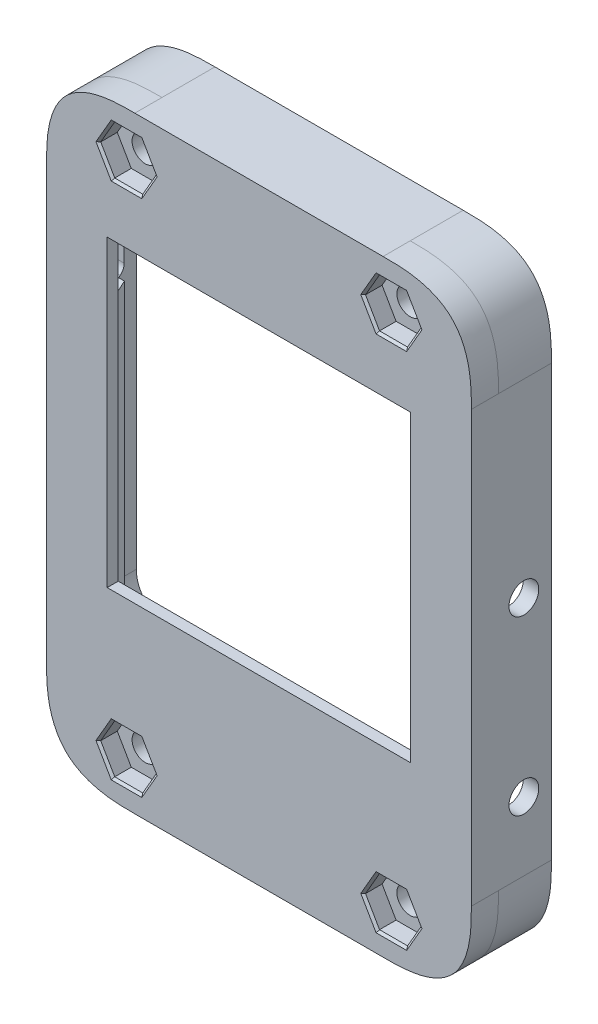
from build123d import *

# Parameters (mm, degrees)
SKETCH_2_W             = 38.5
SKETCH_2_H             = 55
EXTRUDE_1_DEPTH        = 2.46
SKETCH_3_W             = 27.51
SKETCH_3_H             = 27.51
CUT_EXTRUDE_2262_DEPTH = 34.658046586
CUT_EXTRUDE_START      = -1.46
SKETCH_4_W             = 32
SKETCH_4_H             = 37.52
CUT_EXTRUDE_2836_DEPTH = 1.46
FILLET_1_SIZE          = 8
EXTRUDE_3940_DEPTH     = 4.8000508
SKETCH_6_W             = 21
SKETCH_6_H             = 1.5
CUT_EXTRUDE_4625_DEPTH = 1.46
PCB_START              = -1.600051
PCB_DEPTH              = 1.600051
USB_START              = -1.4
USB_DEPTH              = 1.4
SKETCH_9_R             = 3.4
SKETCH_9_R_2           = 1.2
EXTRUDE_2_DEPTH        = 4.8000508
SKETCH_9_2_R           = 1.2
CUT_EXTRUDE_6596_DEPTH = 35.344153046
CUT_EXTRUDE_7273_DEPTH = 1.7
CUT_EXTRUDE_7526_REACH = 49.556
SKETCH_11_R            = 1.35
USB_2_R                = 1
USB_3_SIZE             = 0.2
CHAMFER_8047_SIZE      = 0.2


with BuildPart() as part:
    # 草图2 → 凸台-拉伸1 (new body)
    with BuildSketch(Plane.XY):
        Rectangle(SKETCH_2_W, SKETCH_2_H)
    extrude(amount=EXTRUDE_1_DEPTH)

    # 草图3 → Cut-Extrude 2262 (cut, through all)
    with BuildSketch(Plane.XY.offset(2.46)):
        with Locations((0, 2.765)):
            Rectangle(SKETCH_3_W, SKETCH_3_H)
    extrude(amount=-CUT_EXTRUDE_2262_DEPTH, mode=Mode.SUBTRACT)

    # 草图4 → Cut-Extrude 2836 (cut)
    with BuildSketch(Plane(origin=(0, 0, 0), x_dir=(-1, 0, 0), z_dir=(0, 0, -1)).offset(CUT_EXTRUDE_START)):
        Rectangle(SKETCH_4_W, SKETCH_4_H)
    extrude(amount=CUT_EXTRUDE_2836_DEPTH, mode=Mode.SUBTRACT)

    # 圆角1
    # a fillet whose section is not a circle: 8 mm, written as the material it takes off along each edge
    with BuildSketch(Plane(origin=(19.25, -27.5, -20), x_dir=(0, 1, 0), z_dir=(0, 0, 1)), Plane(origin=(19.25, 27.5, -20), x_dir=(-1, 0, 0), z_dir=(0, 0, 1))) as fillet_1_piece_1:
        with BuildLine():
            add(Edge.make_bspline([(FILLET_1_SIZE, 0), (FILLET_1_SIZE * 0.831801948466, 0), (FILLET_1_SIZE * 0.663603896932, 0), (FILLET_1_SIZE * 0.292893218813, FILLET_1_SIZE * 0.0716919198361), (FILLET_1_SIZE * 0.0716919198361, FILLET_1_SIZE * 0.292893218813), (0, FILLET_1_SIZE * 0.663603896932), (0, FILLET_1_SIZE * 0.831801948466), (0, FILLET_1_SIZE)], knots=[0, 0, 0, 0, 0, 0, 0.5, 0.5, 1, 1, 1, 1, 1, 1], degree=5))
            Line((0, FILLET_1_SIZE), (0, 0))
            Line((0, 0), (FILLET_1_SIZE, 0))
        make_face()
    extrude(amount=42.46, mode=Mode.SUBTRACT)
    with BuildSketch(Plane(origin=(-19.25, -27.5, -20), x_dir=(0, 1, 0), z_dir=(0, 0, 1)), Plane(origin=(-19.25, 27.5, -20), x_dir=(1, 0, 0), z_dir=(0, 0, 1))) as fillet_1_piece_2:
        with BuildLine():
            add(Edge.make_bspline([(FILLET_1_SIZE, 0), (FILLET_1_SIZE * 0.831801948466, 0), (FILLET_1_SIZE * 0.663603896932, 0), (FILLET_1_SIZE * 0.292893218813, -FILLET_1_SIZE * 0.0716919198361), (FILLET_1_SIZE * 0.0716919198361, -FILLET_1_SIZE * 0.292893218813), (0, -FILLET_1_SIZE * 0.663603896932), (0, -FILLET_1_SIZE * 0.831801948466), (0, -FILLET_1_SIZE)], knots=[0, 0, 0, 0, 0, 0, 0.5, 0.5, 1, 1, 1, 1, 1, 1], degree=5))
            Line((0, -FILLET_1_SIZE), (0, 0))
            Line((0, 0), (FILLET_1_SIZE, 0))
        make_face()
    extrude(amount=42.46, mode=Mode.SUBTRACT)

    # Extrude 3940: read off the stored shape, not the designer's step
    # Extrude 3940 outline → Extrude 3940 (add)
    with BuildSketch(Plane(origin=(0, 0, 0), x_dir=(-1, 0, 0), z_dir=(0, 0, -1))):
        with BuildLine():
            Line((19.25, -19.5), (19.25, 19.5))
            add(Edge.make_bspline(
                [(19.25, 19.5), (19.25, 20.580020252), (19.21236359, 21.161838265), (19.154343151, 22.058771223), (18.987229849, 22.808455098), (18.574914705, 24.65813439), (17.495660449, 25.739618136), (16.416563674, 26.820944075), (14.566335811, 27.235468819), (13.817055919, 27.403337362), (12.9181968, 27.461950617), (12.334693381, 27.5), (11.25, 27.5)],
                knots=[0, 0, 0, 0.125, 0.125, 0.25, 0.25, 0.5, 0.5, 0.75, 0.75, 0.875, 0.875, 1, 1, 1], degree=2))
            Line((11.25, 27.5), (-11.25, 27.5))
            add(Edge.make_bspline(
                [(-11.25, 27.5), (-12.330020252, 27.5), (-12.911838265, 27.46236359), (-13.808771223, 27.404343151), (-14.558455098, 27.237229849), (-16.40813439, 26.824914705), (-17.489618136, 25.745660449), (-18.570944075, 24.666563674), (-18.985468819, 22.816335811), (-19.153337362, 22.067055919), (-19.211950617, 21.1681968), (-19.25, 20.584693381), (-19.25, 19.5)],
                knots=[0, 0, 0, 0.125, 0.125, 0.25, 0.25, 0.5, 0.5, 0.75, 0.75, 0.875, 0.875, 1, 1, 1], degree=2))
            Line((-19.25, 19.5), (-19.25, -19.5))
            add(Edge.make_bspline(
                [(-19.25, -19.5), (-19.25, -20.580020252), (-19.21236359, -21.161838265), (-19.154343151, -22.058771223), (-18.987229849, -22.808455098), (-18.574914705, -24.65813439), (-17.495660449, -25.739618136), (-16.416563674, -26.820944075), (-14.566335811, -27.235468819), (-13.817055919, -27.403337362), (-12.9181968, -27.461950617), (-12.334693381, -27.5), (-11.25, -27.5)],
                knots=[0, 0, 0, 0.125, 0.125, 0.25, 0.25, 0.5, 0.5, 0.75, 0.75, 0.875, 0.875, 1, 1, 1], degree=2))
            Line((-11.25, -27.5), (11.25, -27.5))
            add(Edge.make_bspline(
                [(11.25, -27.5), (12.330020252, -27.5), (12.911838265, -27.46236359), (13.808771223, -27.404343151), (14.558455098, -27.237229849), (16.40813439, -26.824914705), (17.489618136, -25.745660449), (18.570944075, -24.666563674), (18.985468819, -22.816335811), (19.153337362, -22.067055919), (19.211950617, -21.1681968), (19.25, -20.584693381), (19.25, -19.5)],
                knots=[0, 0, 0, 0.125, 0.125, 0.25, 0.25, 0.5, 0.5, 0.75, 0.75, 0.875, 0.875, 1, 1, 1], degree=2))
        make_face()
        with BuildLine():
            add(Edge.make_bspline(
                [(17.85, 19.5), (17.85, 20.424125747), (17.842147155, 21.347514943), (17.586385916, 22.709714643), (17.460471496, 23.163708055), (17.182141078, 23.800860799), (17.073157778, 24.008205895), (16.818119881, 24.399226199), (16.673896997, 24.580261327), (16.347287429, 24.909260217), (16.162971776, 25.057823386), (15.774899827, 25.313594138), (15.569880563, 25.422737913), (15.14250697, 25.611445355), (14.922539396, 25.689860704), (14.478900883, 25.821044568), (14.254207223, 25.874300082), (13.573156016, 26.004151683), (13.108502387, 26.053008887), (12.179957339, 26.097214313), (11.715026161, 26.1), (11.25, 26.1)],
                knots=[0, 0, 0, 0, 0.25, 0.25, 0.375, 0.375, 0.4375, 0.4375, 0.5, 0.5, 0.5625, 0.5625, 0.625, 0.625, 0.6875, 0.6875, 0.75, 0.75, 0.875, 0.875, 1, 1, 1, 1], degree=3))
            Line((17.85, 19.5), (17.85, -19.5))
            add(Edge.make_bspline(
                [(11.25, -26.1), (12.174125747, -26.1), (13.097514943, -26.092147155), (14.459714643, -25.836385916), (14.913708055, -25.710471496), (15.550860799, -25.432141078), (15.758205895, -25.323157778), (16.149226199, -25.068119881), (16.330261327, -24.923896997), (16.659260217, -24.597287429), (16.807823386, -24.412971776), (17.063594138, -24.024899827), (17.172737913, -23.819880563), (17.361445355, -23.39250697), (17.439860704, -23.172539396), (17.571044568, -22.728900883), (17.624300082, -22.504207223), (17.754151683, -21.823156016), (17.803008887, -21.358502387), (17.847214313, -20.429957339), (17.85, -19.965026161), (17.85, -19.5)],
                knots=[0, 0, 0, 0, 0.25, 0.25, 0.375, 0.375, 0.4375, 0.4375, 0.5, 0.5, 0.5625, 0.5625, 0.625, 0.625, 0.6875, 0.6875, 0.75, 0.75, 0.875, 0.875, 1, 1, 1, 1], degree=3))
            Line((11.25, -26.1), (-11.25, -26.1))
            add(Edge.make_bspline(
                [(-17.85, -19.5), (-17.85, -20.424125747), (-17.842147155, -21.347514943), (-17.586385916, -22.709714643), (-17.460471496, -23.163708055), (-17.182141078, -23.800860799), (-17.073157778, -24.008205895), (-16.818119881, -24.399226199), (-16.673896997, -24.580261327), (-16.347287429, -24.909260217), (-16.162971776, -25.057823386), (-15.774899827, -25.313594138), (-15.569880563, -25.422737913), (-15.14250697, -25.611445355), (-14.922539396, -25.689860704), (-14.478900883, -25.821044568), (-14.254207223, -25.874300082), (-13.573156016, -26.004151683), (-13.108502387, -26.053008887), (-12.179957339, -26.097214313), (-11.715026161, -26.1), (-11.25, -26.1)],
                knots=[0, 0, 0, 0, 0.25, 0.25, 0.375, 0.375, 0.4375, 0.4375, 0.5, 0.5, 0.5625, 0.5625, 0.625, 0.625, 0.6875, 0.6875, 0.75, 0.75, 0.875, 0.875, 1, 1, 1, 1], degree=3))
            Line((-17.85, -19.5), (-17.85, 19.5))
            add(Edge.make_bspline(
                [(-11.25, 26.1), (-12.174125747, 26.1), (-13.097514943, 26.092147155), (-14.459714643, 25.836385916), (-14.913708055, 25.710471496), (-15.550860799, 25.432141078), (-15.758205895, 25.323157778), (-16.149226199, 25.068119881), (-16.330261327, 24.923896997), (-16.659260217, 24.597287429), (-16.807823386, 24.412971776), (-17.063594138, 24.024899827), (-17.172737913, 23.819880563), (-17.361445355, 23.39250697), (-17.439860704, 23.172539396), (-17.571044568, 22.728900883), (-17.624300082, 22.504207223), (-17.754151683, 21.823156016), (-17.803008887, 21.358502387), (-17.847214313, 20.429957339), (-17.85, 19.965026161), (-17.85, 19.5)],
                knots=[0, 0, 0, 0, 0.25, 0.25, 0.375, 0.375, 0.4375, 0.4375, 0.5, 0.5, 0.5625, 0.5625, 0.625, 0.625, 0.6875, 0.6875, 0.75, 0.75, 0.875, 0.875, 1, 1, 1, 1], degree=3))
            Line((-11.25, 26.1), (11.25, 26.1))
        make_face(mode=Mode.SUBTRACT)
    extrude(amount=EXTRUDE_3940_DEPTH)

    # 草图6 → Cut-Extrude 4625 (cut)
    with BuildSketch(Plane(origin=(0, 0, 0), x_dir=(-1, 0, 0), z_dir=(0, 0, -1))):
        with Locations((2.5, -19.51)):
            Rectangle(SKETCH_6_W, SKETCH_6_H)
    extrude(amount=-CUT_EXTRUDE_4625_DEPTH, mode=Mode.SUBTRACT)

    # 草图7 → PCB干涉 (cut)
    with BuildSketch(Plane(origin=(0, 0, -4.8000508), x_dir=(-1, 0, 0), z_dir=(0, 0, -1)).offset(PCB_START)):
        with BuildLine():
            Line((18.375336551, -15.50003175), (18.375336551, 15.50003175))
            ThreePointArc((18.375336551, 15.50003175), (17.471085836, 17.68308609), (15.288031496, 18.587336805))
            Line((15.288031496, 18.587336805), (-11.712024384, 18.587336805))
            ThreePointArc((-11.712024384, 18.587336805), (-13.895078724, 17.68308609), (-14.799329439, 15.50003175))
            Line((-14.799329439, 15.50003175), (-14.799329439, -15.50003175))
            ThreePointArc((-14.799329439, -15.50003175), (-13.895078724, -17.68308609), (-11.712024384, -18.587336805))
            Line((-11.712024384, -18.587336805), (15.288031496, -18.587336805))
            ThreePointArc((15.288031496, -18.587336805), (17.471085836, -17.68308609), (18.375336551, -15.50003175))
        make_face()
    extrude(amount=PCB_DEPTH, mode=Mode.SUBTRACT)

    # 草图8 → USB (cut)
    with BuildSketch(Plane.ZY.offset(19.25).offset(USB_START)):
        Polygon((-2.39931547, 15.821951992), (-0.39931547, 15.821951992), (-0.39931547, 7.518335028), (-2.39931547, 7.518335028), (-3.702297433, 8.611666713), (-3.702297433, 14.728620308), align=None)
    extrude(amount=USB_DEPTH, mode=Mode.SUBTRACT)

    # 草图9 → 凸台-拉伸2 (add)
    # profile 1 of 4: a face of its own
    with BuildSketch(Plane(origin=(0, 0, -4.8000508), x_dir=(-1, 0, 0), z_dir=(0, 0, -1))):
        with Locations((-12, 23.5)):
            Circle(SKETCH_9_R)
        with Locations((-12, 23.5)):
            Circle(SKETCH_9_R_2, mode=Mode.SUBTRACT)
    # profile 2 of 4: a face of its own
    with BuildSketch(Plane(origin=(0, 0, -4.8000508), x_dir=(-1, 0, 0), z_dir=(0, 0, -1))):
        with Locations((12, 23.5)):
            Circle(SKETCH_9_R)
        with Locations((12, 23.5)):
            Circle(SKETCH_9_R_2, mode=Mode.SUBTRACT)
    # profile 3 of 4: a face of its own
    with BuildSketch(Plane(origin=(0, 0, -4.8000508), x_dir=(-1, 0, 0), z_dir=(0, 0, -1))):
        with Locations((-12, -23.5)):
            Circle(SKETCH_9_R)
        with Locations((-12, -23.5)):
            Circle(SKETCH_9_R_2, mode=Mode.SUBTRACT)
    # profile 4 of 4: a face of its own
    with BuildSketch(Plane(origin=(0, 0, -4.8000508), x_dir=(-1, 0, 0), z_dir=(0, 0, -1))):
        with BuildLine():
            Line((10.969272102, -20.26), (13.030727898, -20.26))
            ThreePointArc((13.030727898, -20.26), (12, -26.9), (10.969272102, -20.26))
        make_face()
        with Locations((12, -23.5)):
            Circle(SKETCH_9_R_2, mode=Mode.SUBTRACT)
    extrude(amount=-EXTRUDE_2_DEPTH)

    # 草图9<2> → Cut-Extrude 6596 (cut, through all)
    with BuildSketch(Plane(origin=(0, 0, -4.8000508), x_dir=(-1, 0, 0), z_dir=(0, 0, -1))):
        with Locations((-12, 23.5)):
            Circle(SKETCH_9_2_R)
        with Locations((12, 23.5)):
            Circle(SKETCH_9_2_R)
        with Locations((-12, -23.5)):
            Circle(SKETCH_9_2_R)
        with Locations((12, -23.5)):
            Circle(SKETCH_9_2_R)
    extrude(amount=-CUT_EXTRUDE_6596_DEPTH, mode=Mode.SUBTRACT)

    # 草图10 → Cut-Extrude 7273 (cut)
    with BuildSketch(Plane.XY.offset(2.46)):
        Polygon((-9.459658816, 23.5), (-10.729829408, 25.7), (-13.270170592, 25.7), (-14.540341184, 23.5), (-13.270170592, 21.3), (-10.729829408, 21.3), align=None)
        Polygon((14.540341184, 23.5), (13.270170592, 25.7), (10.729829408, 25.7), (9.459658816, 23.5), (10.729829408, 21.3), (13.270170592, 21.3), align=None)
        Polygon((-9.459658816, -23.5), (-10.729829408, -21.3), (-13.270170592, -21.3), (-14.540341184, -23.5), (-13.270170592, -25.7), (-10.729829408, -25.7), align=None)
        Polygon((14.540341184, -23.5), (13.270170592, -21.3), (10.729829408, -21.3), (9.459658816, -23.5), (10.729829408, -25.7), (13.270170592, -25.7), align=None)
    extrude(amount=-CUT_EXTRUDE_7273_DEPTH, mode=Mode.SUBTRACT)

    # 草图11 → Cut-Extrude 7526 (cut, up to next)
    with BuildSketch(Plane(origin=(19.25, 0, 0), x_dir=(0, 0, -1), z_dir=(1, 0, 0)), mode=Mode.PRIVATE) as cut_extrude_7526_sk1:
        with Locations(Location((2.29907464, -13.293026416, 0), (0, 0, 90))):
            Circle(SKETCH_11_R)
    cut_extrude_7526_tool1 = extrude(cut_extrude_7526_sk1.sketch, amount=-CUT_EXTRUDE_7526_REACH, mode=Mode.PRIVATE) & part.part
    # 草图11 → Cut-Extrude 7526 (cut, up to next)
    with BuildSketch(Plane(origin=(19.25, 0, 0), x_dir=(0, 0, -1), z_dir=(1, 0, 0)), mode=Mode.PRIVATE) as cut_extrude_7526_sk2:
        with Locations(Location((2.29907464, 2.328004826, 0), (0, 0, 90))):
            Circle(SKETCH_11_R)
    cut_extrude_7526_tool2 = extrude(cut_extrude_7526_sk2.sketch, amount=-CUT_EXTRUDE_7526_REACH, mode=Mode.PRIVATE) & part.part
    add(cut_extrude_7526_tool1.solids().sort_by_distance((19.25, -13.293026, -2.299075))[0], mode=Mode.SUBTRACT)
    add(cut_extrude_7526_tool2.solids().sort_by_distance((19.25, 2.328005, -2.299075))[0], mode=Mode.SUBTRACT)

    # USB 2
    usb_2_edges = [part.edges().sort_by_distance(p)[0] for p in [
        (-18.812668275, 8.611666713, -3.702297433),
        (-18.55, 7.518335028, -2.39931547),
        (-18.812668275, 14.728620308, -3.702297433),
        (-18.55, 7.518335028, -0.39931547),
        (-18.55, 15.821951992, -0.39931547),
        (-18.55, 15.821951992, -2.39931547),
    ]]
    fillet(usb_2_edges, radius=USB_2_R)

    # USB 3
    usb_3_edges = [part.edges().sort_by_distance(p)[0] for p in [
        (-19.25, 8.032110256, -3.011608944),
        (-19.25, 11.67014351, -3.702297433),
        (-19.25, 7.518335028, -1.717330353),
        (-19.25, 11.67014351, -0.39931547),
        (-19.25, 15.821951992, -1.717330353),
        (-19.25, 15.308176764, -3.011608944),
        (-19.25, 8.655356109, -3.60860522),
        (-19.25, 7.578642407, -2.377365379),
        (-19.25, 7.811228247, -0.692208689),
        (-19.25, 15.529058774, -0.692208689),
        (-19.25, 15.761644613, -2.377365379),
        (-19.25, 14.684930911, -3.60860522),
    ]]
    chamfer(usb_3_edges, length=USB_3_SIZE)

    # Chamfer 8047
    chamfer_8047_edges = [part.edges().sort_by_distance(p)[0] for p in [
        (13.905255888, 22.4, 2.46),
        (13.905255888, 24.6, 2.46),
        (12, 25.7, 2.46),
        (10.094744112, 24.6, 2.46),
        (10.094744112, 22.4, 2.46),
        (12, 21.3, 2.46),
        (-10.094744112, -24.6, 2.46),
        (-10.094744112, -22.4, 2.46),
        (-12, -21.3, 2.46),
        (-13.905255888, -22.4, 2.46),
        (-13.905255888, -24.6, 2.46),
        (-12, -25.7, 2.46),
        (13.905255888, -24.6, 2.46),
        (13.905255888, -22.4, 2.46),
        (12, -21.3, 2.46),
        (10.094744112, -22.4, 2.46),
        (10.094744112, -24.6, 2.46),
        (12, -25.7, 2.46),
        (-10.094744112, 22.4, 2.46),
        (-10.094744112, 24.6, 2.46),
        (-12, 25.7, 2.46),
        (-13.905255888, 24.6, 2.46),
        (-13.905255888, 22.4, 2.46),
        (-12, 21.3, 2.46),
    ]]
    chamfer(chamfer_8047_edges, length=CHAMFER_8047_SIZE)


solid = part.part
